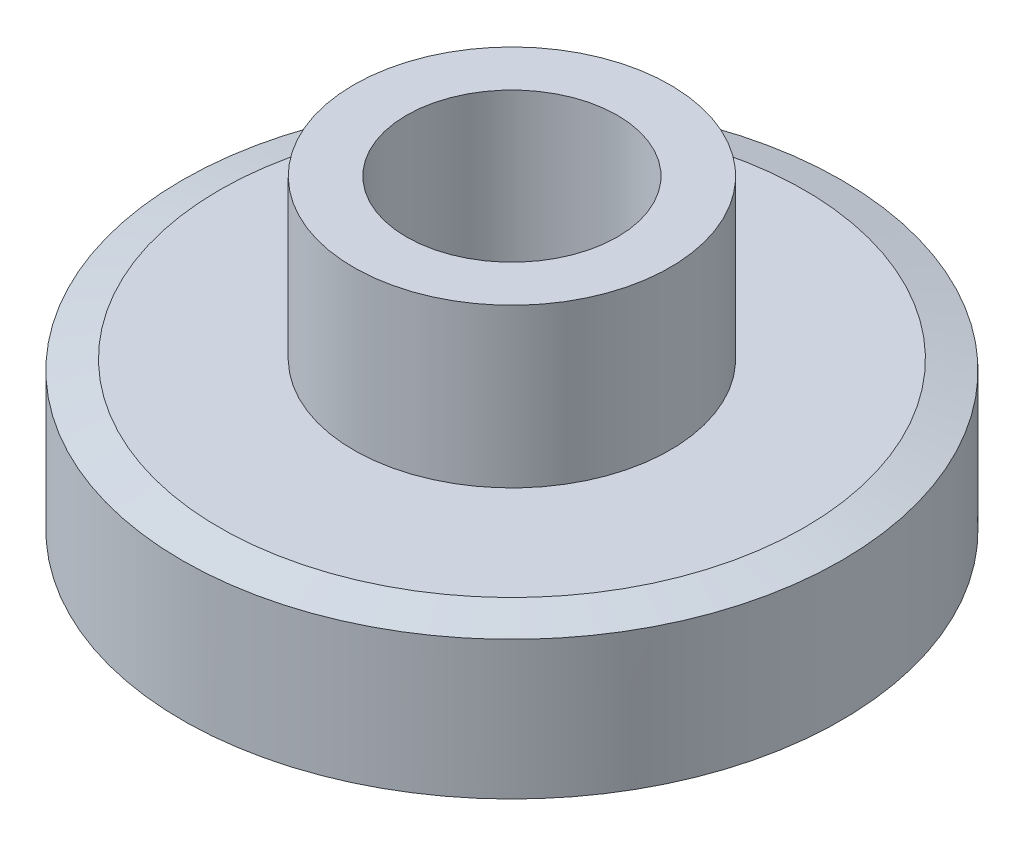
from build123d import *

# Parameters (mm, degrees)
CHAMFER_2_SIZE           = 0.705
CHAMFER_2_SIZE2          = 0.188904181
CHAMFER_3_SIZE           = 0.705
CHAMFER_3_SIZE2          = 0.188904181
CUT_EXTRUDE_2_DEPTH      = 11.68293031
CUT_EXTRUDE_2_DEPTH_BACK = 11.68293031
SKETCH_4_R               = 2


with BuildPart() as part:
    # Эскиз2 → Повернуть2 (revolve)
    with BuildSketch(Plane.XY):
        Polygon((0, 0), (6.25, 0), (6.25, 3), (3, 3), (3, 6), (0, 6), align=None)
    revolve(axis=Axis((0, 6, 0), (0, -1, 0)))

    # Фаска2
    chamfer_2_edges = [part.edges().sort_by_distance(p)[0] for p in [
        (-6.25, 3, 0),
    ]]
    chamfer_2_side = [part.faces().sort_by_distance(p)[0] for p in [
        (-6.073223305, 3, 0),
    ]]
    chamfer(chamfer_2_edges, length=CHAMFER_2_SIZE, length2=CHAMFER_2_SIZE2, reference=chamfer_2_side[0])

    # Фаска3
    chamfer_3_edges = [part.edges().sort_by_distance(p)[0] for p in [
        (-6.25, 0, 0),
    ]]
    chamfer_3_side = [part.faces().sort_by_distance(p)[0] for p in [
        (0, 0, 0),
    ]]
    chamfer(chamfer_3_edges, length=CHAMFER_3_SIZE, length2=CHAMFER_3_SIZE2, reference=chamfer_3_side[0])

    # Эскиз4 → Вырез-Вытянуть2 (cut, two sides: drawn at the far end of the back side and taken through both)
    with BuildSketch(Plane(origin=(0, 6, 0), x_dir=(1, 0, 0), z_dir=(0, 1, 0)).offset(-CUT_EXTRUDE_2_DEPTH_BACK)):
        Circle(SKETCH_4_R)
    extrude(amount=CUT_EXTRUDE_2_DEPTH + CUT_EXTRUDE_2_DEPTH_BACK, mode=Mode.SUBTRACT)


solid = part.part
